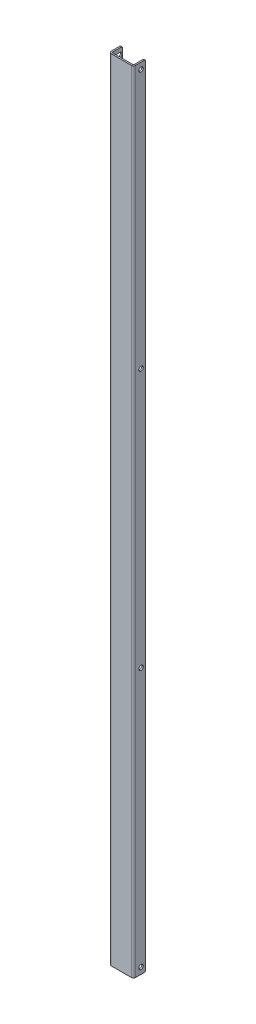
from build123d import *

# Parameters (mm, degrees)
BASE_FLANGE1_DEPTH = 1613
CUT_EXTRUDE1_REACH = 1615.878
FILLET1_R          = 3
CUT_EXTRUDE2_REACH = 1615.878
SKETCH7_R          = 4.5
LPATTERN1_COUNT    = 4
LPATTERN1_PITCH    = 529


# Sheet-metal steps are written as plain solids
with BuildPart() as part:
    # Sketch1 → Base-Flange1 (new body)
    with BuildSketch(Plane(origin=(0, 0, 0), x_dir=(1, 0, 0), z_dir=(0, 1, 0))):
        with BuildLine():
            Line((-25, 25), (-25, 4.5))
            ThreePointArc((-25, 4.5), (-23.681980515, 1.318019485), (-20.5, 0))
            Line((-20.5, 0), (20.5, 0))
            ThreePointArc((20.5, 0), (23.681980515, 1.318019485), (25, 4.5))
            Line((25, 4.5), (25, 25))
            Line((25, 25), (22, 25))
            Line((22, 25), (22, 4.5))
            ThreePointArc((22, 4.5), (21.560660172, 3.439339828), (20.5, 3))
            Line((20.5, 3), (-20.5, 3))
            ThreePointArc((-20.5, 3), (-21.560660172, 3.439339828), (-22, 4.5))
            Line((-22, 4.5), (-22, 25))
            Line((-22, 25), (-25, 25))
        make_face()
    extrude(amount=BASE_FLANGE1_DEPTH)

    # Sketch6 → Cut-Extrude1 (cut, up to next)
    with BuildSketch(Plane(origin=(-22, 0, 0), x_dir=(0, 0, -1), z_dir=(1, 0, 0)), mode=Mode.PRIVATE) as cut_extrude1_sk1:
        with BuildLine():
            Line((12.5, 18), (18.5, 18))
            ThreePointArc((18.5, 18), (23.5, 13), (18.5, 8))
            Line((18.5, 8), (12.5, 8))
            ThreePointArc((12.5, 8), (7.5, 13), (12.5, 18))
        make_face()
    cut_extrude1_tool1 = extrude(cut_extrude1_sk1.sketch, amount=-CUT_EXTRUDE1_REACH, mode=Mode.PRIVATE) & part.part
    cut_extrude1 = cut_extrude1_tool1.solids().sort_by_distance((-22, 13, -15.5))[0]
    add(cut_extrude1, mode=Mode.SUBTRACT)

    # Fillet1
    fillet1_edges = [part.edges().sort_by_distance(p)[0] for p in [
        (23.5, 0, -25),
        (-23.5, 0, -25),
        (23.5, 1613, -25),
        (-23.5, 1613, -25),
    ]]
    fillet(fillet1_edges, radius=FILLET1_R)

    # Sketch7 → Cut-Extrude2 (cut, up to next)
    with BuildSketch(Plane.ZY.offset(-22), mode=Mode.PRIVATE) as cut_extrude2_sk1:
        with Locations((-15.5, 13)):
            Circle(SKETCH7_R)
    cut_extrude2_tool1 = extrude(cut_extrude2_sk1.sketch, amount=-CUT_EXTRUDE2_REACH, mode=Mode.PRIVATE) & part.part
    cut_extrude2 = cut_extrude2_tool1.solids().sort_by_distance((22, 13, -15.5))[0]
    add(cut_extrude2, mode=Mode.SUBTRACT)

    # LPattern1: Cut-Extrude1, Cut-Extrude2 ×4
    with Locations(*[(0, i * LPATTERN1_PITCH, 0) for i in range(1, LPATTERN1_COUNT)]):
        add(cut_extrude1, mode=Mode.SUBTRACT)
        add(cut_extrude2, mode=Mode.SUBTRACT)


solid = part.part
